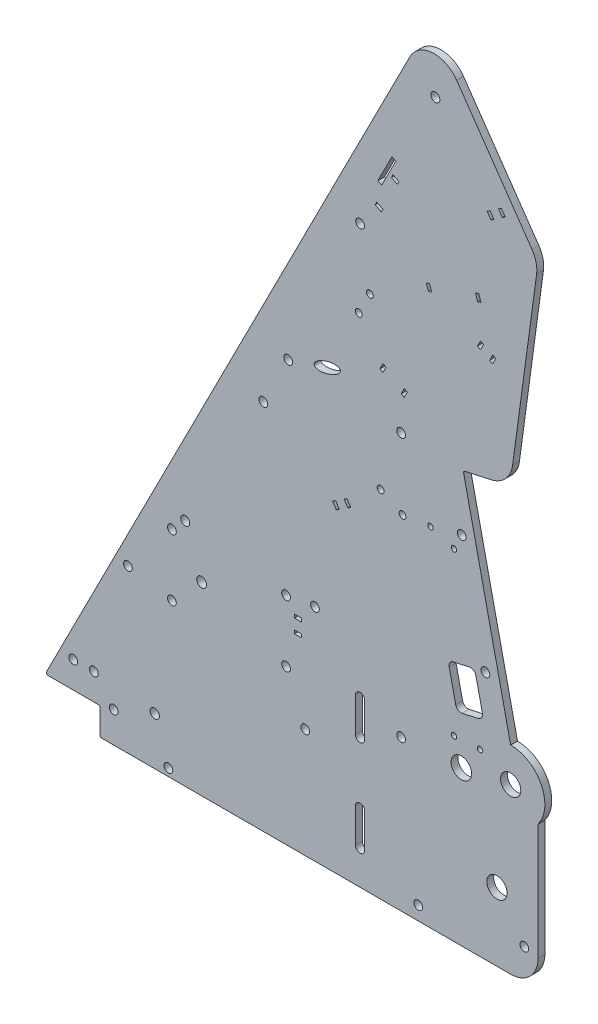
from build123d import *

# Parameters (mm, degrees)
BOSS_EXTRUDE1_DEPTH     = 3.175
SKETCH2_R               = 2.0955
SKETCH2_R_2             = 2.286
SKETCH2_R_3             = 2.032
SKETCH2_R_4             = 4.699
CUT_EXTRUDE1_DEPTH      = 421.976111717
SKETCH7_R               = 2.159
CUT_EXTRUDE2_DEPTH      = 421.976111717
CUT_EXTRUDE3_REACH      = 422.976
SKETCH10_R              = 2.032
FILLET1_R               = 12.7
FILLET2_R               = 0.79375
SKETCH12_R              = 2.032
CUT_EXTRUDE5_DEPTH      = 411.989226146
SKETCH13_R              = 2.032
SKETCH13_R_2            = 1.6
SKETCH13_RX             = 6.35
SKETCH13_RY             = 2.38125
SKETCH13_W              = 3.175
SKETCH13_H              = 1.5875
CUT_EXTRUDE6_DEPTH      = 411.989226146
CUT_EXTRUDE7_DEPTH      = 411.989226285
CUT_EXTRUDE7_DEPTH_BACK = 411.989226285
SKETCH14_R              = 1.27
SKETCH14_R_2            = 2.032
FILLET3_R               = 2.54
SKETCH15_R              = 4.7625
CUT_EXTRUDE8_DEPTH      = 411.989226285


with BuildPart() as part:
    # Sketch1 → Boss-Extrude1 (new body)
    with BuildSketch(Plane.XY):
        with BuildLine():
            Line((228.6, -12.7), (228.6, 53.975))
            ThreePointArc((228.6, 53.975), (230.099031657, 70.599515829), (215.9, 79.375))
            Line((215.9, 79.375), (193.909735224, 178.566674323))
            Line((193.909735224, 178.566674323), (215.607913982, 183.377044743))
            Line((215.607913982, 183.377044743), (228.6, 279.4))
            Line((228.6, 279.4), (178.754725958, 351.413083686))
            Line((178.754725958, 351.413083686), (0, 0))
            Line((0, 0), (25.4, 0))
            Line((25.4, 0), (25.4, -12.7))
            Line((25.4, -12.7), (228.6, -12.7))
        make_face()
    extrude(amount=BOSS_EXTRUDE1_DEPTH)

    # Sketch2 → Cut-Extrude1 (cut, through all)
    with BuildSketch(Plane.XY.offset(3.175)):
        with Locations((64.943150167, 94.057839899)):
            Circle(SKETCH2_R)
        with Locations((180.975, 322.164313376)):
            Circle(SKETCH2_R)
        with Locations((72.544547852, 73.173171402)):
            Circle(SKETCH2_R_2)
        with Locations((193.207821773, 152.394364194)):
            Circle(SKETCH2_R_3)
        with Locations((215.9, 63.5)):
            Circle(SKETCH2_R_4)
        with Locations((173.0375, -6.35)):
            Circle(SKETCH2_R_3)
        with Locations((204.202954161, 102.798527032)):
            Circle(SKETCH2_R_3)
        with Locations((209.55, 19.05)):
            Circle(SKETCH2_R_4)
        with Locations((165.1, 179.3875)):
            Circle(SKETCH2_R_3)
        with Locations((111.724047852, 87.460671402)):
            Circle(SKETCH2_R_3)
        with Locations((111.724047852, 58.885671402)):
            Circle(SKETCH2_R_3)
        with Locations((58.765047852, 58.885671402)):
            Circle(SKETCH2_R_3)
        with Locations((58.765047852, 87.460671402)):
            Circle(SKETCH2_R_3)
    extrude(amount=-CUT_EXTRUDE1_DEPTH, mode=Mode.SUBTRACT)

    # Sketch7 → Cut-Extrude2 (cut, through all)
    with BuildSketch(Plane.XY.offset(3.175)):
        with Locations((50.8, 9.525)):
            Circle(SKETCH7_R)
        with BuildLine():
            Line((143.891, 3.175), (143.891, 19.05))
            ThreePointArc((143.891, 19.05), (146.05, 21.209), (148.209, 19.05))
            Line((148.209, 19.05), (148.209, 3.175))
            ThreePointArc((148.209, 3.175), (146.05, 1.016), (143.891, 3.175))
        make_face()
        with BuildLine():
            Line((143.891, 47.625), (143.891, 63.5))
            ThreePointArc((143.891, 63.5), (146.05, 65.659), (148.209, 63.5))
            Line((148.209, 63.5), (148.209, 47.625))
            ThreePointArc((148.209, 47.625), (146.05, 45.466), (143.891, 47.625))
        make_face()
    extrude(amount=-CUT_EXTRUDE2_DEPTH, mode=Mode.SUBTRACT)

    # Sketch10 → Cut-Extrude3 (cut, up to next)
    with BuildSketch(Plane.XY.offset(3.175), mode=Mode.PRIVATE) as cut_extrude3_sk1:
        with Locations((120.65, 38.1)):
            Circle(SKETCH10_R)
    cut_extrude3_tool1 = extrude(cut_extrude3_sk1.sketch, amount=-CUT_EXTRUDE3_REACH, mode=Mode.PRIVATE) & part.part
    # Sketch10 → Cut-Extrude3 (cut, up to next)
    with BuildSketch(Plane.XY.offset(3.175), mode=Mode.PRIVATE) as cut_extrude3_sk2:
        with Locations((165.1, 57.15)):
            Circle(SKETCH10_R)
    cut_extrude3_tool2 = extrude(cut_extrude3_sk2.sketch, amount=-CUT_EXTRUDE3_REACH, mode=Mode.PRIVATE) & part.part
    # Sketch10 → Cut-Extrude3 (cut, up to next)
    with BuildSketch(Plane.XY.offset(3.175), mode=Mode.PRIVATE) as cut_extrude3_sk3:
        with Locations((13.046467246, 12.334704411)):
            Circle(SKETCH10_R)
    cut_extrude3_tool3 = extrude(cut_extrude3_sk3.sketch, amount=-CUT_EXTRUDE3_REACH, mode=Mode.PRIVATE) & part.part
    # Sketch10 → Cut-Extrude3 (cut, up to next)
    with BuildSketch(Plane.XY.offset(3.175), mode=Mode.PRIVATE) as cut_extrude3_sk4:
        with Locations((22.571467246, 12.334704411)):
            Circle(SKETCH10_R)
    cut_extrude3_tool4 = extrude(cut_extrude3_sk4.sketch, amount=-CUT_EXTRUDE3_REACH, mode=Mode.PRIVATE) & part.part
    # Sketch10 → Cut-Extrude3 (cut, up to next)
    with BuildSketch(Plane.XY.offset(3.175), mode=Mode.PRIVATE) as cut_extrude3_sk5:
        with Locations((38.360434174, 62.564025462)):
            Circle(SKETCH10_R)
    cut_extrude3_tool5 = extrude(cut_extrude3_sk5.sketch, amount=-CUT_EXTRUDE3_REACH, mode=Mode.PRIVATE) & part.part
    add(cut_extrude3_tool1.solids().sort_by_distance((120.65, 38.1, 3.175))[0], mode=Mode.SUBTRACT)
    add(cut_extrude3_tool2.solids().sort_by_distance((165.1, 57.15, 3.175))[0], mode=Mode.SUBTRACT)
    add(cut_extrude3_tool3.solids().sort_by_distance((13.046467, 12.334704, 3.175))[0], mode=Mode.SUBTRACT)
    add(cut_extrude3_tool4.solids().sort_by_distance((22.571467, 12.334704, 3.175))[0], mode=Mode.SUBTRACT)
    add(cut_extrude3_tool5.solids().sort_by_distance((38.360434, 62.564025, 3.175))[0], mode=Mode.SUBTRACT)

    # Fillet1
    fillet1_edges = [part.edges().sort_by_distance(p)[0] for p in [
        (228.6, -12.7, 1.5875),
        (178.754725958, 351.413083686, 1.5875),
        (215.607913982, 183.377044743, 1.5875),
        (228.6, 279.4, 1.5875),
    ]]
    fillet(fillet1_edges, radius=FILLET1_R)

    # Fillet2
    fillet2_edges = [part.edges().sort_by_distance(p)[0] for p in [
        (25.4, -12.7, 1.5875),
        (25.4, 0, 1.5875),
        (193.909735224, 178.566674323, 1.5875),
        (0, 0, 1.5875),
    ]]
    fillet(fillet2_edges, radius=FILLET2_R)

    # Sketch12 → Cut-Extrude5 (cut, through all)
    with BuildSketch(Plane.XY.offset(3.175)):
        with Locations((31.75, 1.5875)):
            Circle(SKETCH12_R)
        with Locations((173.0375, -6.35)):
            Circle(SKETCH12_R)
        with Locations((222.25, 1.5875)):
            Circle(SKETCH12_R)
        with Locations((57.15, -9.2075)):
            Circle(SKETCH12_R)
    extrude(amount=-CUT_EXTRUDE5_DEPTH, mode=Mode.SUBTRACT)

    # Sketch13 → Cut-Extrude6 (cut, through all)
    with BuildSketch(Plane.XY.offset(3.175)):
        with Locations((112.7125, 182.5625)):
            Circle(SKETCH13_R)
        with Locations((146.05, 254)):
            Circle(SKETCH13_R)
        with Locations((101.196445848, 159.923142748)):
            Circle(SKETCH13_R)
        with Locations((145.425401324, 217.737567137)):
            Circle(SKETCH13_R_2)
        with Locations((150.594024053, 227.898538502)):
            Circle(SKETCH13_R_2)
        with Locations((155.598407534, 151.914877867)):
            Circle(SKETCH13_R_2)
        with Locations((165.759378899, 146.746255137)):
            Circle(SKETCH13_R_2)
        with Locations(Location((130.826142263, 188.461522288), (0, 0, 18.038739462))):
            Ellipse(SKETCH13_RX, SKETCH13_RY)
        Polygon((178.26972852, 245.992253978), (176.758236028, 245.506922447), (177.728899089, 242.483937462), (179.240391581, 242.969268992), align=None)
        Polygon((160.847712251, 288.198438198), (154.283561384, 275.294004564), (156.066187939, 274.387228647), (162.630338806, 287.29166228), align=None)
        Polygon((200.609634347, 249.830809719), (202.12112684, 250.316141249), (201.150463779, 253.339126235), (199.638971286, 252.853794704), align=None)
        Polygon((160.590482388, 279.78010172), (163.420402045, 278.340594951), (164.140155429, 279.75555478), (161.310235773, 281.195061549), align=None)
        Polygon((153.789663007, 266.410402556), (153.069909623, 264.995442728), (155.899829279, 263.555935959), (156.619582664, 264.970895787), align=None)
        Polygon((203.330342332, 234.029927366), (201.915382504, 234.74968075), (200.475875735, 231.919761094), (201.890835563, 231.200007709), align=None)
        Polygon((206.135715047, 229.040747556), (207.550674876, 228.320994171), (208.990181645, 231.150913828), (207.575221816, 231.870667212), align=None)
        Polygon((211.540543439, 292.889033628), (210.235229039, 291.98553456), (212.042227175, 289.374905759), (213.347541575, 290.278404827), align=None)
        Polygon((206.319285837, 289.275037356), (205.013971437, 288.371538288), (206.820969573, 285.760909487), (208.126283974, 286.664408555), align=None)
        Polygon((133.35043444, 136.102010662), (135.081463368, 133.440401403), (136.412267998, 134.305915867), (134.681239069, 136.967525126), align=None)
        Polygon((155.228084113, 200.119678264), (156.643043941, 199.39992488), (158.08255071, 202.229844536), (156.667590882, 202.949597921), align=None)
        Polygon((165.132802911, 195.081404573), (166.547762739, 194.361651188), (167.987269508, 197.191570845), (166.57230968, 197.911324229), align=None)
        Polygon((140.404681887, 136.90245926), (138.673652958, 139.564068519), (140.004457588, 140.429582984), (141.735486516, 137.767973724), align=None)
        with Locations((117.248547852, 81.078921402)):
            Rectangle(SKETCH13_W, SKETCH13_H)
        with Locations((117.248547852, 74.728921402)):
            Rectangle(SKETCH13_W, SKETCH13_H)
    extrude(amount=-CUT_EXTRUDE6_DEPTH, mode=Mode.SUBTRACT)

    # Sketch14 → Cut-Extrude7 (cut, two sides: drawn at the far end of the back side and taken through both)
    with BuildSketch(Plane.XY.offset(3.175).offset(-CUT_EXTRUDE7_DEPTH_BACK)):
        with Locations((189.602197334, 69.980636704)):
            Circle(SKETCH14_R)
        with Locations((201.708862449, 70.509225118)):
            Circle(SKETCH14_R)
        with Locations((165.1, 57.15)):
            Circle(SKETCH14_R_2)
        with Locations((125.14977438, 89.522927623)):
            Circle(SKETCH14_R_2)
        with Locations((178.721644858, 148.532438598)):
            Circle(SKETCH14_R)
        with Locations((189.622629605, 145.09537131)):
            Circle(SKETCH14_R)
        Polygon((186.844411154, 98.950230697), (199.243370445, 101.699013794), (203.36654509, 83.100574858), (190.9675858, 80.351791761), align=None)
    extrude(amount=CUT_EXTRUDE7_DEPTH + CUT_EXTRUDE7_DEPTH_BACK, mode=Mode.SUBTRACT)

    # Fillet3
    fillet3_edges = [part.edges().sort_by_distance(p)[0] for p in [
        (199.243370445, 101.699013794, 1.5875),
        (186.844411154, 98.950230697, 1.5875),
        (190.9675858, 80.351791761, 1.5875),
        (203.36654509, 83.100574858, 1.5875),
    ]]
    fillet(fillet3_edges, radius=FILLET3_R)

    # Sketch15 → Cut-Extrude8 (cut, through all)
    with BuildSketch(Plane.XY.offset(3.175)):
        with Locations((193.04, 58.801)):
            Circle(SKETCH15_R)
    extrude(amount=-CUT_EXTRUDE8_DEPTH, mode=Mode.SUBTRACT)


solid = part.part
